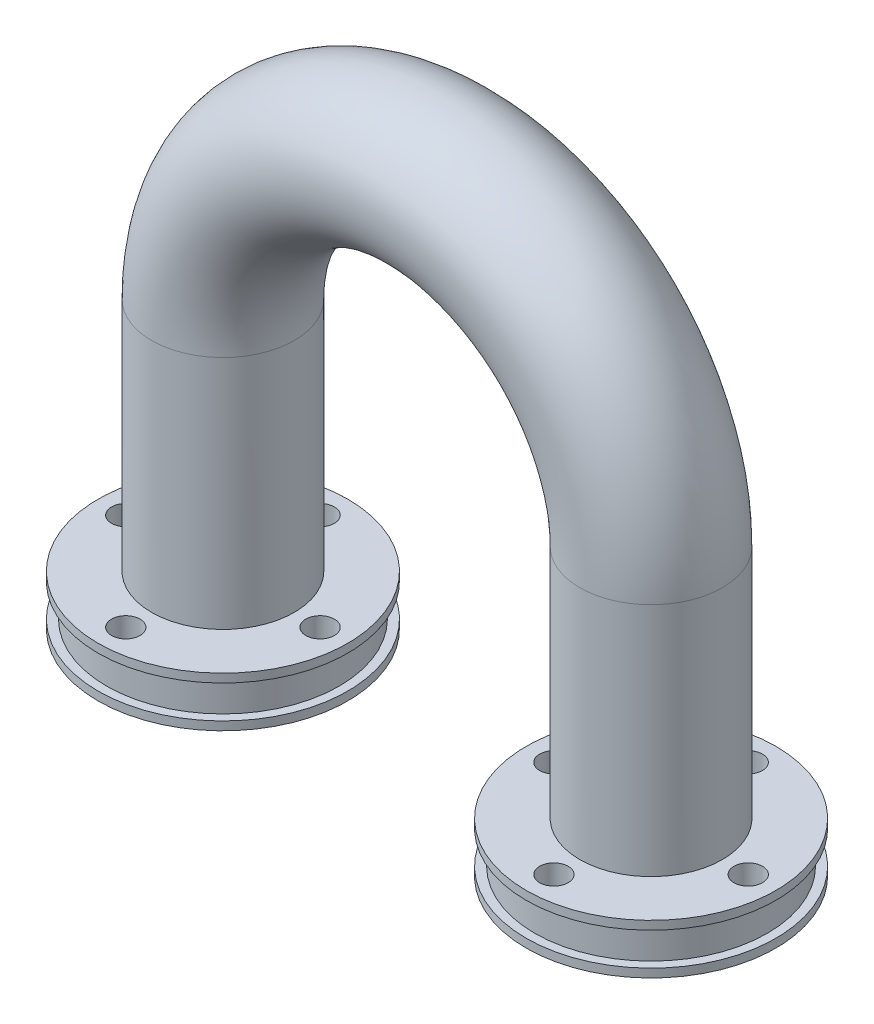
from build123d import *
from build123d.topology import SkipClean

# Parameters (mm, degrees)
SKETCH3_R               = 10
SKETCH3_R_2             = 6
SKETCH7_R               = 2
CUT_EXTRUDE1_DEPTH      = 89.834115151
CIRPATTERN1_COUNT       = 4
MIRROR2_COPY_1_SKETCH_R = 2
MIRROR2_COPY_1_DEPTH    = 89.834115151
MIRROR2_COPY_2_SKETCH_R = 2
MIRROR2_COPY_2_DEPTH    = 89.834115151
MIRROR2_COPY_3_SKETCH_R = 2
MIRROR2_COPY_3_DEPTH    = 89.834115151
MIRROR2_COPY_4_SKETCH_R = 2
MIRROR2_COPY_4_DEPTH    = 89.834115151


with BuildPart() as part:
    # Sweep-Thin2: sweep along a path in Sketch1
    with BuildLine(Plane.XY) as sweep_thin2_path:
        Line((-30, -33), (-30, 0))
        ThreePointArc((-30, 0), (0, 30), (30, 0))
        Line((30, 0), (30, -33))
    # Sketch3 → Sweep-Thin2 (sweep)
    with BuildSketch(Plane(origin=(0, -33, 0), x_dir=(1, 0, 0), z_dir=(0, 1, 0))):
        with Locations((-30, 0)):
            Circle(SKETCH3_R)
        with Locations((-30, 0)):
            Circle(SKETCH3_R_2, mode=Mode.SUBTRACT)
    sweep(path=sweep_thin2_path.line)

    # Sketch4 → Revolve2 (revolve)
    with SkipClean():  # the faces are left unmerged after this step: merging them gives an invalid solid
        with BuildSketch(Plane.XY):
            Polygon((36, -33), (47.5, -33), (47.5, -34.2), (46.3, -34.2), (46.3, -38.8), (47.5, -38.8), (47.5, -40), (36, -40), align=None)
        revolve2 = revolve(axis=Axis((30, -33, 0), (0, -1, 0)))
    add(part.part.scale(1), mode=Mode.REPLACE)  # the faces are merged on a copy

    # Sketch7 → Cut-Extrude1 (cut, through all)
    with BuildSketch(Plane(origin=(0, -33, 0), x_dir=(1, 0, 0), z_dir=(0, 1, 0))):
        with Locations((43.614766478, 0)):
            Circle(SKETCH7_R)
    cut_extrude1 = extrude(amount=-CUT_EXTRUDE1_DEPTH, mode=Mode.SUBTRACT)

    # CirPattern1: Cut-Extrude1 ×4 about axis
    cirpattern1_axis = Axis((30, 0, 0), (0, -1, 0))
    for i in range(1, CIRPATTERN1_COUNT):
        add(cut_extrude1.rotate(cirpattern1_axis, i * 360 / CIRPATTERN1_COUNT), mode=Mode.SUBTRACT)

    # Mirror2: Revolve2 across plane
    with SkipClean():  # the faces are left unmerged after this step: merging them gives an invalid solid
        add(revolve2.mirror(Plane(origin=(0, 0, 0), x_dir=(0, 0, 1), z_dir=(1, 0, 0))))

    # Mirror2 copy 1 sketch → Mirror2 copy 1 (cut, through all)
    with BuildSketch(Plane(origin=(-30, -33, -30), x_dir=(0, 0, 1), z_dir=(0, 1, 0))):
        with Locations((43.614766478, 0)):
            Circle(MIRROR2_COPY_1_SKETCH_R)
    extrude(amount=-MIRROR2_COPY_1_DEPTH, mode=Mode.SUBTRACT)

    # Mirror2 copy 2 sketch → Mirror2 copy 2 (cut, through all)
    with BuildSketch(Plane(origin=(-60, -33, 0), x_dir=(1, 0, 0), z_dir=(0, 1, 0))):
        with Locations((43.614766478, 0)):
            Circle(MIRROR2_COPY_2_SKETCH_R)
    extrude(amount=-MIRROR2_COPY_2_DEPTH, mode=Mode.SUBTRACT)

    # Mirror2 copy 3 sketch → Mirror2 copy 3 (cut, through all)
    with BuildSketch(Plane(origin=(-30, -33, 30), x_dir=(0, 0, -1), z_dir=(0, 1, 0))):
        with Locations((43.614766478, 0)):
            Circle(MIRROR2_COPY_3_SKETCH_R)
    extrude(amount=-MIRROR2_COPY_3_DEPTH, mode=Mode.SUBTRACT)

    # Mirror2 copy 4 sketch → Mirror2 copy 4 (cut, through all)
    with BuildSketch(Plane(origin=(0, -33, 0), x_dir=(-1, 0, 0), z_dir=(0, 1, 0))):
        with Locations((43.614766478, 0)):
            Circle(MIRROR2_COPY_4_SKETCH_R)
    extrude(amount=-MIRROR2_COPY_4_DEPTH, mode=Mode.SUBTRACT)


solid = part.part
